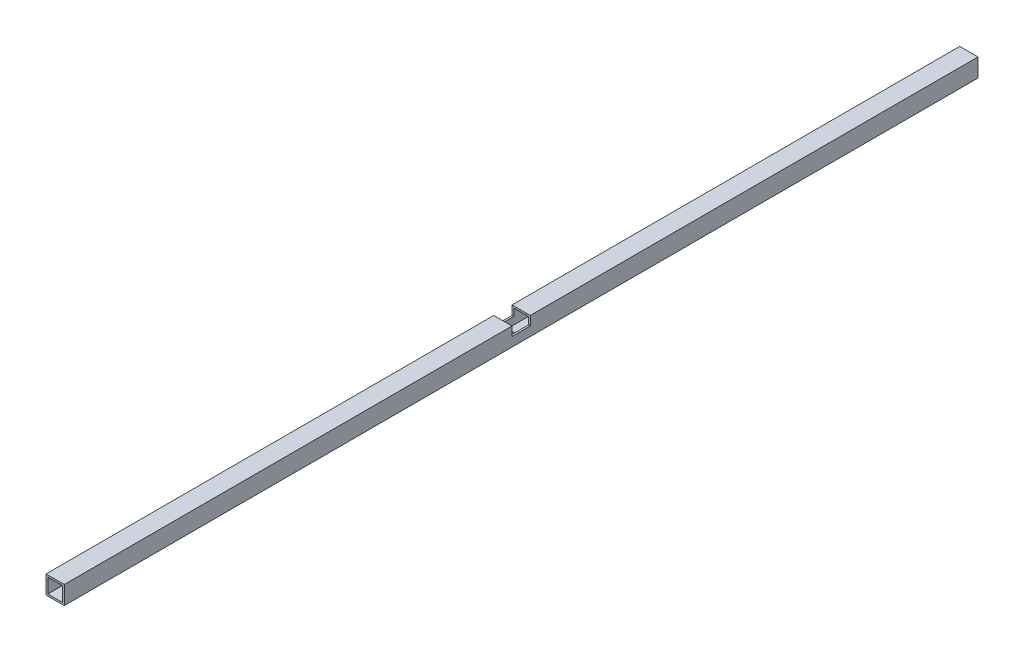
from build123d import *

# Parameters (mm, degrees)
BOSS_EXTRU_3_DEPTH                            = 500
BOSS_EXTRU_3_DEPTH_BACK                       = 0.0001
ESQUISSE3_W                                   = 10
ESQUISSE3_H                                   = 10
ESQUISSE4_W                                   = 10
ESQUISSE4_H                                   = 10
ENL_V_MAT_EXTRU_1_DEPTH                       = 5
ESQUISSE8_W                                   = 8
ESQUISSE8_H                                   = 8.019868715
ENL_V_MAT_EXTRU_4_DEPTH                       = 503.314714265
TROU_POUR_TARAUDAGE_POUR_TROU_TARAUD_M4_D     = 3.3
TROU_POUR_TARAUDAGE_POUR_TROU_TARAUD_M4_DEPTH = 10
TROU_POUR_TARAUDAGE_POUR_TROU_TARAUD_M4_TIP   = 0.991420021


with BuildPart() as part:
    # Esquisse3 → Boss.-Extru.3 (new, two sides: drawn at the far end of the back side and taken through both)
    with BuildSketch(Plane.XY.offset(-BOSS_EXTRU_3_DEPTH_BACK)):
        with Locations((-39.715537472, 12.902314812)):
            Rectangle(ESQUISSE3_W, ESQUISSE3_H)
    extrude(amount=BOSS_EXTRU_3_DEPTH + BOSS_EXTRU_3_DEPTH_BACK)

    # Esquisse4 → Enlèv. mat.-Extru.1 (cut)
    with BuildSketch(Plane(origin=(0, 17.902314812, 0), x_dir=(-1, 0, 0), z_dir=(0, 1, 0))):
        with Locations((39.715537472, 250)):
            Rectangle(ESQUISSE4_W, ESQUISSE4_H)
    extrude(amount=-ENL_V_MAT_EXTRU_1_DEPTH, mode=Mode.SUBTRACT)

    # Esquisse8 → Enlèv. mat.-Extru.4 (cut, through all)
    with BuildSketch(Plane.XY.offset(500)):
        with Locations((-39.715537472, 12.91224917)):
            Rectangle(ESQUISSE8_W, ESQUISSE8_H)
    extrude(amount=-ENL_V_MAT_EXTRU_4_DEPTH, mode=Mode.SUBTRACT)

    # Trou pour taraudage pour trou taraudé M4x0.72
    with Locations(Plane(origin=(0, 8.902314812, 0), x_dir=(-1, 0, 0), z_dir=(0, 1, 0))):
        with Locations((39.715537472, 250)):
            Hole(TROU_POUR_TARAUDAGE_POUR_TROU_TARAUD_M4_D / 2, depth=TROU_POUR_TARAUDAGE_POUR_TROU_TARAUD_M4_DEPTH)
            with Locations((0, 0, -(TROU_POUR_TARAUDAGE_POUR_TROU_TARAUD_M4_DEPTH + TROU_POUR_TARAUDAGE_POUR_TROU_TARAUD_M4_TIP / 2))):  # 118° drill point
                Cone(0, TROU_POUR_TARAUDAGE_POUR_TROU_TARAUD_M4_D / 2, TROU_POUR_TARAUDAGE_POUR_TROU_TARAUD_M4_TIP, mode=Mode.SUBTRACT)


solid = part.part
